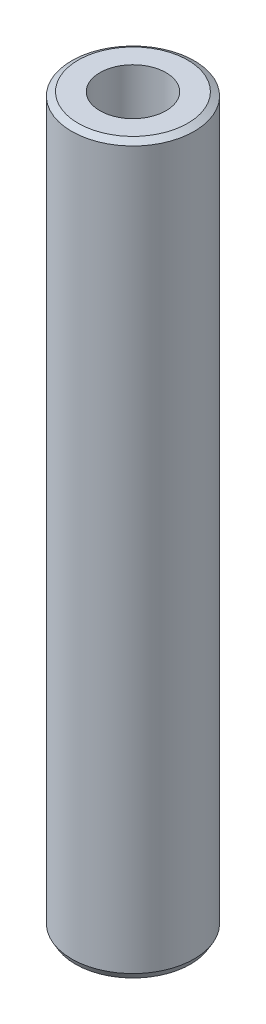
from build123d import *
from OCP.BRepFilletAPI import BRepFilletAPI_MakeChamfer

# Parameters (mm, degrees)
SKETCH1_R           = 5
BOSS_EXTRUDE1_DEPTH = 59.331869884
SKETCH2_R           = 2.697701986
CUT_EXTRUDE1_DEPTH  = 60.751742936
CHAMFER1_SIZE       = 0.305171885
CHAMFER1_SIZE2      = 0.528573209


with BuildPart() as part:
    # Sketch1 → Boss-Extrude1 (new body)
    with BuildSketch(Plane(origin=(0, 0, 0), x_dir=(1, 0, 0), z_dir=(0, 1, 0))):
        Circle(SKETCH1_R)
    extrude(amount=BOSS_EXTRUDE1_DEPTH)

    # Sketch2 → Cut-Extrude1 (cut, through all)
    with BuildSketch(Plane(origin=(0, 0, 0), x_dir=(1, 0, 0), z_dir=(0, 1, 0))):
        Circle(SKETCH2_R)
    extrude(amount=CUT_EXTRUDE1_DEPTH, mode=Mode.SUBTRACT)

    # Chamfer1: one chamfer whose edges measure the first distance from different faces: ONE call of the kernel's chamfer builder (chamfer() names one face for all edges)
    chamfer1_edges_1 = [part.edges().sort_by_distance(p)[0] for p in [
        (-5, 59.331869884, 0),
    ]]
    chamfer1_side_1 = [part.faces().sort_by_distance(p)[0] for p in [
        (-5, 29.665934942, 0),
    ]]
    chamfer1_edges_2 = [part.edges().sort_by_distance(p)[0] for p in [
        (-5, 0, 0),
    ]]
    chamfer1_side_2 = [part.faces().sort_by_distance(p)[0] for p in [
        (-4.858578644, 0, 0),
    ]]
    chamfer1 = BRepFilletAPI_MakeChamfer(part.part.solid().wrapped)
    for e in chamfer1_edges_1:
        chamfer1.Add(CHAMFER1_SIZE, CHAMFER1_SIZE2, e.wrapped, chamfer1_side_1[0].wrapped)  # the first distance lies on this face
    for e in chamfer1_edges_2:
        chamfer1.Add(CHAMFER1_SIZE, CHAMFER1_SIZE2, e.wrapped, chamfer1_side_2[0].wrapped)  # the first distance lies on this face
    add(Compound.cast(chamfer1.Shape()), mode=Mode.REPLACE)


solid = part.part
